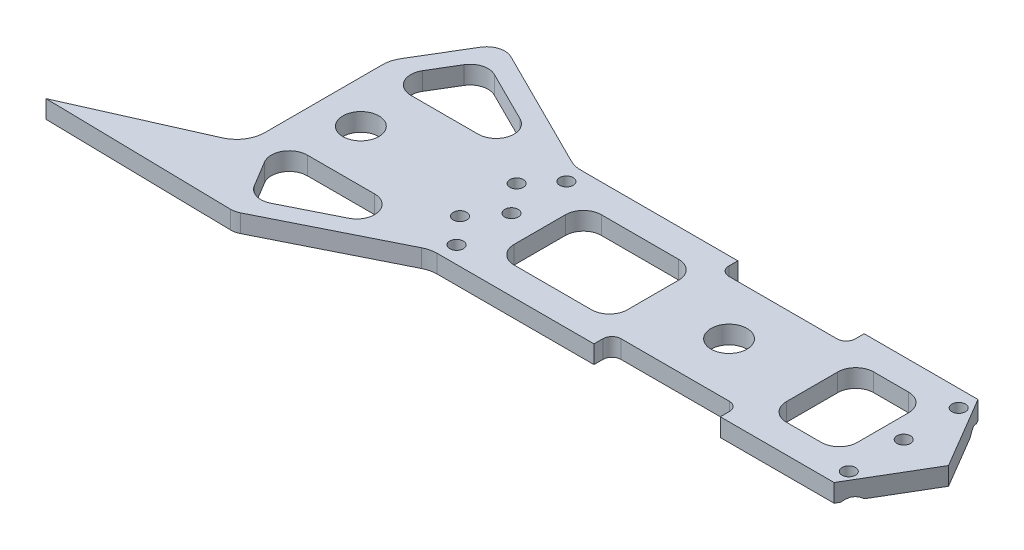
from build123d import *

# Parameters (mm, degrees)
CROQUIS1_R              = 6.35
SALIENTE_EXTRUIR1_DEPTH = 6.35
REDONDEO1_R             = 10
CORTAR_EXTRUIR2_DEPTH   = 225.405229946
CORTAR_EXTRUIR3_DEPTH   = 225.405229946
CROQUIS7_R              = 2.38125
CORTAR_EXTRUIR4_DEPTH   = 225.405229946
CROQUIS8_R              = 2.38125
CORTAR_EXTRUIR5_DEPTH   = 225.405229946
CHAFL_N1_SIZE           = 2.5


with BuildPart() as part:
    # Croquis1 → Saliente-Extruir1 (new body)
    with BuildSketch(Plane(origin=(0, 0, 0), x_dir=(1, 0, 0), z_dir=(0, 1, 0))):
        with BuildLine():
            Line((37.5, -25.4), (52.5, 0))
            Line((52.5, 0), (37.5, 25.4))
            Line((37.5, 25.4), (-105, 25.4))
            Line((-105, 25.4), (-149.746813481, 47.731727951))
            ThreePointArc((-149.746813481, 47.731727951), (-154.357530471, 48.146831931), (-158.024774803, 45.321528145))
            Line((-158.024774803, 45.321528145), (-170, 25.4))
            Line((-170, 25.4), (-170, -25.4))
            Line((-170, -25.4), (-219.03156103, -47.147007635))
            Line((-219.03156103, -47.147007635), (-152.702210171, -48.398869348))
            ThreePointArc((-152.702210171, -48.398869348), (-151.184140049, -48.244143221), (-149.746813481, -47.731727951))
            Line((-149.746813481, -47.731727951), (-105, -25.4))
            Line((-105, -25.4), (37.5, -25.4))
        make_face()
        with Locations(Location((-155, 0, 0), (0, 0, 270))):
            Circle(CROQUIS1_R, mode=Mode.SUBTRACT)
        with Locations(Location((-25, 0, 0), (0, 0, 270))):
            Circle(CROQUIS1_R, mode=Mode.SUBTRACT)
        with BuildLine():
            Line((-129.045100716, 30.303281185), (-147.329198773, 39.428299747))
            ThreePointArc((-147.329198773, 39.428299747), (-151.939915763, 39.843403727), (-155.607160095, 37.018099941))
            Line((-155.607160095, 37.018099941), (-161.092389512, 27.893081378))
            ThreePointArc((-161.092389512, 27.893081378), (-161.177056347, 21.495189828), (-155.65, 18.271553233))
            Line((-155.65, 18.271553233), (-131.880672526, 18.271553233))
            ThreePointArc((-131.880672526, 18.271553233), (-125.699998109, 23.164925706), (-129.045100716, 30.303281185))
        make_face(mode=Mode.SUBTRACT)
        with BuildLine():
            Line((-129.045100716, -30.303281185), (-147.329198773, -39.428299747))
            ThreePointArc((-147.329198773, -39.428299747), (-151.939915763, -39.843403727), (-155.607160095, -37.018099941))
            Line((-155.607160095, -37.018099941), (-161.092389512, -27.893081378))
            ThreePointArc((-161.092389512, -27.893081378), (-161.177056347, -21.495189828), (-155.65, -18.271553233))
            Line((-155.65, -18.271553233), (-131.880672526, -18.271553233))
            ThreePointArc((-131.880672526, -18.271553233), (-125.699998109, -23.164925706), (-129.045100716, -30.303281185))
        make_face(mode=Mode.SUBTRACT)
    extrude(amount=SALIENTE_EXTRUIR1_DEPTH)

    # Redondeo1
    redondeo1_edges = [part.edges().sort_by_distance(p)[0] for p in [
        (-105, 3.175, -25.4),
        (-170, 3.175, -25.4),
        (-170, 3.175, 25.4),
        (-105, 3.175, 25.4),
    ]]
    fillet(redondeo1_edges, radius=REDONDEO1_R)

    # Croquis5 → Cortar-Extruir2 (cut, through all)
    with BuildSketch(Plane.XZ):
        with BuildLine():
            Line((-5.875, 19.05), (-44.125, 19.05))
            ThreePointArc((-44.125, 19.05), (-46.37006403, 19.97993597), (-47.3, 22.225))
            Line((-47.3, 22.225), (-47.3, 25.4))
            Line((-47.3, 25.4), (-44.125, 25.4))
            Line((-44.125, 25.4), (-5.875, 25.4))
            Line((-5.875, 25.4), (-2.7, 25.4))
            Line((-2.7, 25.4), (-2.7, 22.225))
            ThreePointArc((-2.7, 22.225), (-3.62993597, 19.97993597), (-5.875, 19.05))
        make_face()
        with BuildLine():
            Line((-5.875, -19.05), (-44.125, -19.05))
            ThreePointArc((-44.125, -19.05), (-46.37006403, -19.97993597), (-47.3, -22.225))
            Line((-47.3, -22.225), (-47.3, -25.4))
            Line((-47.3, -25.4), (-44.125, -25.4))
            Line((-44.125, -25.4), (-5.875, -25.4))
            Line((-5.875, -25.4), (-2.7, -25.4))
            Line((-2.7, -25.4), (-2.7, -22.225))
            ThreePointArc((-2.7, -22.225), (-3.62993597, -19.97993597), (-5.875, -19.05))
        make_face()
    extrude(amount=-CORTAR_EXTRUIR2_DEPTH, mode=Mode.SUBTRACT)

    # Croquis6 → Cortar-Extruir3 (cut, through all)
    with BuildSketch(Plane.XZ):
        with BuildLine():
            Line((-85.475, 15.4), (-58.175, 15.4))
            ThreePointArc((-58.175, 15.4), (-53.684871939, 13.540128061), (-51.825, 9.05))
            Line((-51.825, 9.05), (-51.825, -9.05))
            ThreePointArc((-51.825, -9.05), (-53.684871939, -13.540128061), (-58.175, -15.4))
            Line((-58.175, -15.4), (-85.475, -15.4))
            ThreePointArc((-85.475, -15.4), (-89.965128061, -13.540128061), (-91.825, -9.05))
            Line((-91.825, -9.05), (-91.825, 9.05))
            ThreePointArc((-91.825, 9.05), (-89.965128061, 13.540128061), (-85.475, 15.4))
        make_face()
        with BuildLine():
            Line((10.675, 15.4), (22.975, 15.4))
            ThreePointArc((22.975, 15.4), (27.465128061, 13.540128061), (29.325, 9.05))
            Line((29.325, 9.05), (29.325, -9.05))
            ThreePointArc((29.325, -9.05), (27.465128061, -13.540128061), (22.975, -15.4))
            Line((22.975, -15.4), (10.675, -15.4))
            ThreePointArc((10.675, -15.4), (6.184871939, -13.540128061), (4.325, -9.05))
            Line((4.325, -9.05), (4.325, 9.05))
            ThreePointArc((4.325, 9.05), (6.184871939, 13.540128061), (10.675, 15.4))
        make_face()
    extrude(amount=-CORTAR_EXTRUIR3_DEPTH, mode=Mode.SUBTRACT)

    # Croquis7 → Cortar-Extruir4 (cut, through all)
    with BuildSketch(Plane.XZ):
        with Locations(Location((-101.825, 0, 0), (0, 0, 270))):
            Circle(CROQUIS7_R)
        with Locations(Location((-101.825, 19.4, 0), (0, 0, 270))):
            Circle(CROQUIS7_R)
        with Locations(Location((-101.825, -19.4, 0), (0, 0, 270))):
            Circle(CROQUIS7_R)
        with Locations(Location((36.675, -19.4, 0), (0, 0, 270))):
            Circle(CROQUIS7_R)
        with Locations(Location((36.675, 19.4, 0), (0, 0, 270))):
            Circle(CROQUIS7_R)
        with Locations(Location((36.675, 0, 0), (0, 0, 270))):
            Circle(CROQUIS7_R)
    extrude(amount=-CORTAR_EXTRUIR4_DEPTH, mode=Mode.SUBTRACT)

    # Croquis8 → Cortar-Extruir5 (cut, through all)
    with BuildSketch(Plane.XZ):
        with Locations(Location((-110, -10, 0), (0, 0, 270))):
            Circle(CROQUIS8_R)
        with Locations(Location((-110, 10, 0), (0, 0, 270))):
            Circle(CROQUIS8_R)
    extrude(amount=-CORTAR_EXTRUIR5_DEPTH, mode=Mode.SUBTRACT)

    # Chaflán1
    # the kernel refuses this chamfer: 2.5 mm, written as the material it takes off along each edge
    with BuildSketch(Plane(origin=(-101.825, 0, 19.4), x_dir=(0, 0, -1), z_dir=(-1, 0, 0))) as chafl_n1_piece_1:
        Polygon((2.38125 + CHAFL_N1_SIZE, 0), (2.38125, -CHAFL_N1_SIZE), (2.38125, 0), align=None)
    revolve(axis=Axis((-101.825, 0, 19.4), (0, -1, 0)), mode=Mode.SUBTRACT)
    with BuildSketch(Plane(origin=(36.675, 0, 19.4), x_dir=(0, 0, -1), z_dir=(-1, 0, 0))) as chafl_n1_piece_2:
        Polygon((2.38125 + CHAFL_N1_SIZE, 0), (2.38125, -CHAFL_N1_SIZE), (2.38125, 0), align=None)
    revolve(axis=Axis((36.675, 0, 19.4), (0, -1, 0)), mode=Mode.SUBTRACT)
    with BuildSketch(Plane(origin=(-101.825, 0, 0), x_dir=(0, 0, -1), z_dir=(-1, 0, 0))) as chafl_n1_piece_3:
        Polygon((2.38125 + CHAFL_N1_SIZE, 0), (2.38125, -CHAFL_N1_SIZE), (2.38125, 0), align=None)
    revolve(axis=Axis((-101.825, 0, 0), (0, -1, 0)), mode=Mode.SUBTRACT)
    with BuildSketch(Plane(origin=(-101.825, 0, -19.4), x_dir=(0, 0, -1), z_dir=(-1, 0, 0))) as chafl_n1_piece_4:
        Polygon((2.38125 + CHAFL_N1_SIZE, 0), (2.38125, -CHAFL_N1_SIZE), (2.38125, 0), align=None)
    revolve(axis=Axis((-101.825, 0, -19.4), (0, -1, 0)), mode=Mode.SUBTRACT)
    with BuildSketch(Plane(origin=(36.675, 0, 0), x_dir=(0, 0, -1), z_dir=(-1, 0, 0))) as chafl_n1_piece_5:
        Polygon((2.38125 + CHAFL_N1_SIZE, 0), (2.38125, -CHAFL_N1_SIZE), (2.38125, 0), align=None)
    revolve(axis=Axis((36.675, 0, 0), (0, -1, 0)), mode=Mode.SUBTRACT)
    with BuildSketch(Plane(origin=(36.675, 0, -19.4), x_dir=(0, 0, -1), z_dir=(-1, 0, 0))) as chafl_n1_piece_6:
        Polygon((2.38125 + CHAFL_N1_SIZE, 0), (2.38125, -CHAFL_N1_SIZE), (2.38125, 0), align=None)
    revolve(axis=Axis((36.675, 0, -19.4), (0, -1, 0)), mode=Mode.SUBTRACT)


solid = part.part
